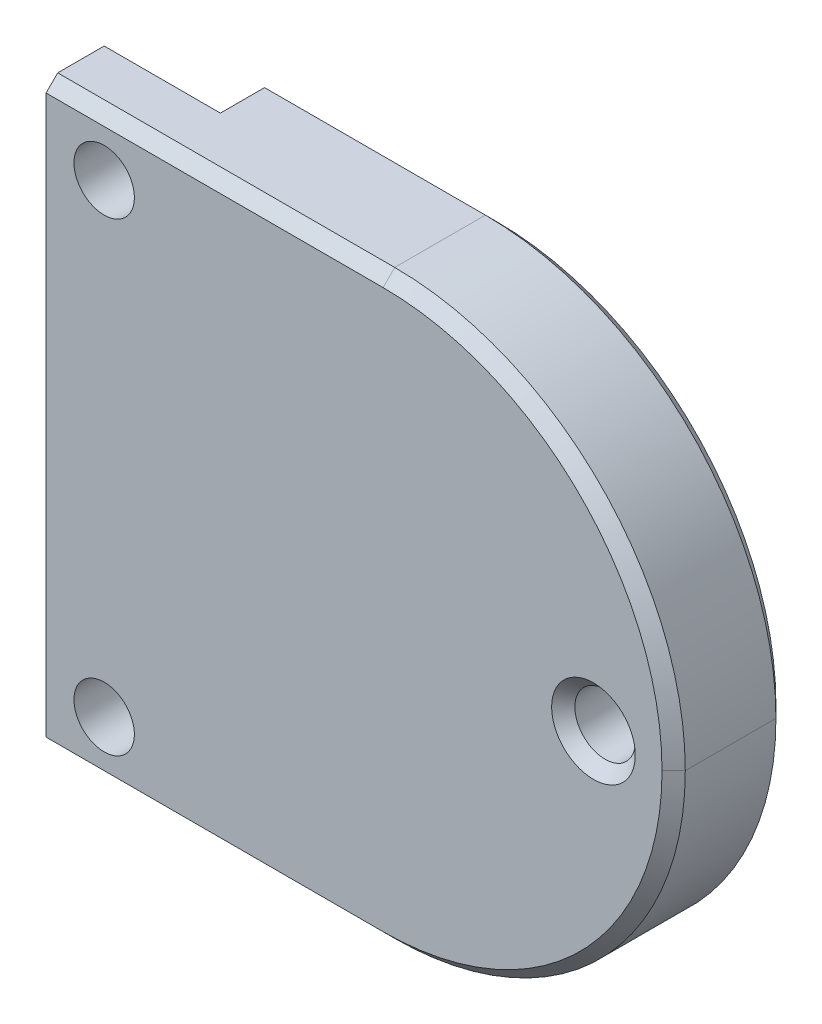
from build123d import *

# Parameters (mm, degrees)
SKETCH1_W           = 54
SKETCH1_H           = 50
SKETCH1_R           = 2.6
BOSS_EXTRUDE1_DEPTH = 5
SKETCH2_W           = 4.8
SKETCH2_H           = 50
BOSS_EXTRUDE2_DEPTH = 44
SKETCH3_R           = 2.6
CUT_EXTRUDE1_DEPTH  = 10
FILLET1_R           = 25
CHAMFER1_SIZE       = 1
CHAMFER2_SIZE       = 1
CHAMFER3_SIZE       = 1


with BuildPart() as part:
    # Sketch1 → Boss-Extrude1 (new body)
    with BuildSketch(Plane.XY):
        with Locations((27, 25)):
            Rectangle(SKETCH1_W, SKETCH1_H)
        with Locations((5, 45)):
            Circle(SKETCH1_R, mode=Mode.SUBTRACT)
        with Locations((5, 5)):
            Circle(SKETCH1_R, mode=Mode.SUBTRACT)
    extrude(amount=BOSS_EXTRUDE1_DEPTH)

    # Sketch2 → Boss-Extrude2 (add)
    with BuildSketch(Plane.ZY.offset(-10)):
        with Locations((-2.4, 25)):
            Rectangle(SKETCH2_W, SKETCH2_H)
    extrude(amount=-BOSS_EXTRUDE2_DEPTH)

    # Sketch3 → Cut-Extrude1 (cut)
    with BuildSketch(Plane(origin=(0, 0, -4.8), x_dir=(-1, 0, 0), z_dir=(0, 0, -1))):
        with Locations(Location((-47.1, 25, 0), (0, 0, 90))):
            Circle(SKETCH3_R)
    extrude(amount=-CUT_EXTRUDE1_DEPTH, mode=Mode.SUBTRACT)

    # Fillet1
    fillet1_edges = [part.edges().sort_by_distance(p)[0] for p in [
        (54, 0, 0.1),
        (54, 50, 0.1),
    ]]
    fillet(fillet1_edges, radius=FILLET1_R - 0.0001)  # a hair under: the kernel refuses the full size

    # Chamfer1
    chamfer1_edges = [part.edges().sort_by_distance(p)[0] for p in [
        (47.1, 22.4, 5),
    ]]
    chamfer(chamfer1_edges, length=CHAMFER1_SIZE)

    # Chamfer2
    chamfer2_edges = [part.edges().sort_by_distance(p)[0] for p in [
        (14.50005, 50, 5),
        (46.677698819, 42.677698819, 5),
        (46.677698819, 7.322301181, 5),
        (14.50005, 0, 5),
    ]]
    chamfer(chamfer2_edges, length=CHAMFER2_SIZE)

    # Chamfer3
    chamfer3_edges = [part.edges().sort_by_distance(p)[0] for p in [
        (19.50005, 50, -4.8),
        (19.50005, 0, -4.8),
        (46.677698819, 42.677698819, -4.8),
        (46.677698819, 7.322301181, -4.8),
    ]]
    chamfer(chamfer3_edges, length=CHAMFER3_SIZE)


solid = part.part
